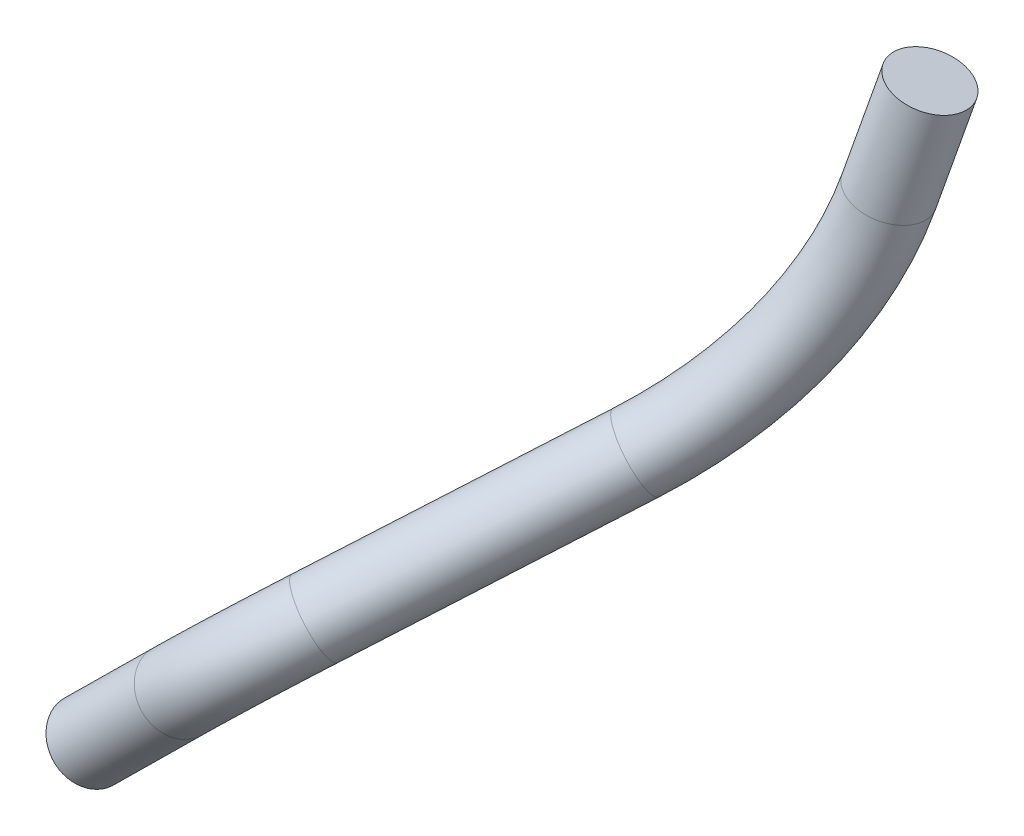
from build123d import *

# Parameters (mm, degrees)
SWEEP1_PROFILE_R = 4.699


with BuildPart() as part:
    # Sweep1: sweep along a curve in space
    with BuildLine() as sweep1_path:
        Line((249.910297785, 151.47778822, 165.053326343), (253.620262722, 165.140017683, 163.321797155))
        ThreePointArc((232.530115202, 120.798605776, 181.3218423), (242.76888223, 133.838892333, 170.506053914), (249.910297785, 151.47778822, 165.053326343))
        Line((212.68354018, 103.221774342, 204.171639505), (232.530115202, 120.798605776, 181.3218423))
        ThreePointArc((212.68354018, 103.221774342, 204.171639505), (206.966928941, 97.979936613, 208.753998167), (200.591028535, 91.818718112, 210.3483))
        Line((200.591028535, 91.818718112, 210.3483), (188.850650435, 80.210806065, 210.3483))
    # Sweep1 profile (on start of the path) → Sweep1 (sweep)
    with BuildSketch(Plane(origin=(188.850650435, 80.210806065, 210.3483), x_dir=(-0.703083709644402, 0.7111070926609201, 0), z_dir=(0.7111070926609201, 0.703083709644402, -7.402383437355376e-14))):
        Circle(SWEEP1_PROFILE_R)
    sweep(path=sweep1_path.line)


solid = part.part
